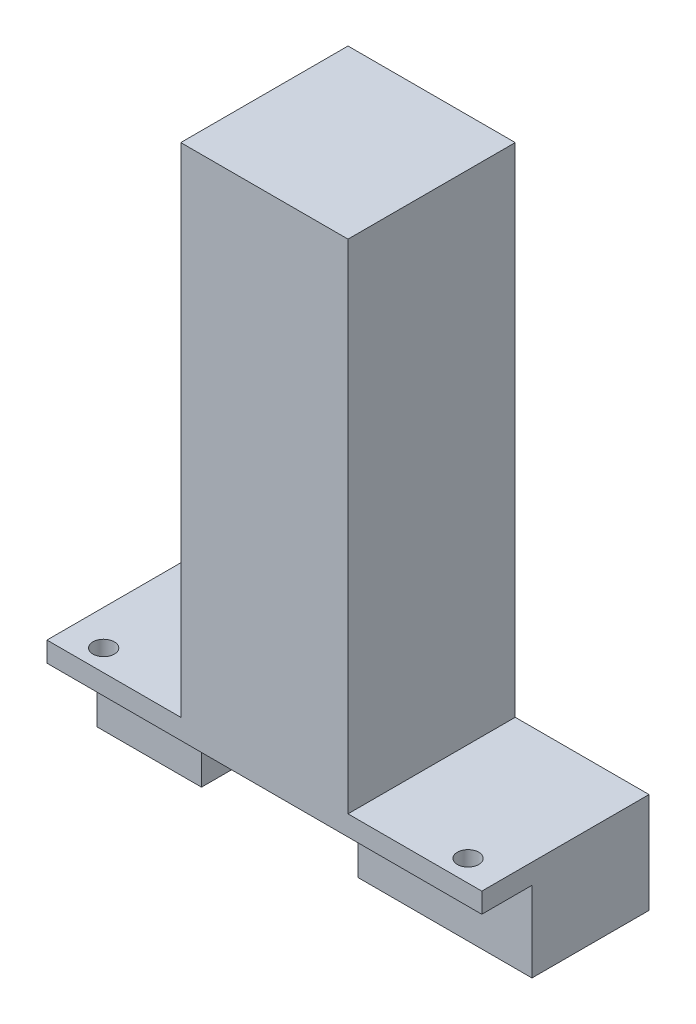
from build123d import *

# Parameters (mm, degrees)
SKETCH2_W           = 65
SKETCH2_H           = 25
BOSS_EXTRUDE1_DEPTH = 3
SKETCH3_W           = 15.6
SKETCH3_H           = 17.5
BOSS_EXTRUDE2_DEPTH = 12
SKETCH5_R           = 1.6
CUT_EXTRUDE1_DEPTH  = 38.91437722
SKETCH6_W           = 25
SKETCH6_H           = 25
BOSS_EXTRUDE3_DEPTH = 74.4


with BuildPart() as part:
    # Sketch2 → Boss-Extrude1 (new body)
    with BuildSketch(Plane(origin=(0, 0, 0), x_dir=(1, 0, 0), z_dir=(0, 1, 0))):
        Rectangle(SKETCH2_W, SKETCH2_H)
    extrude(amount=BOSS_EXTRUDE1_DEPTH)

    # Sketch3 → Boss-Extrude2 (add)
    with BuildSketch(Plane.XZ):
        with Locations((-24.7, -3.75)):
            Rectangle(SKETCH3_W, SKETCH3_H)
        Polygon((32.5, 5), (6.5, 5), (6.5, 0), (12.5, 0), (12.5, -12.5), (32.5, -12.5), align=None)
    extrude(amount=BOSS_EXTRUDE2_DEPTH)

    # Sketch5 → Cut-Extrude1 (cut, through all)
    with BuildSketch(Plane(origin=(0, 3, 0), x_dir=(1, 0, 0), z_dir=(0, 1, 0))):
        with Locations((27.234893969, -9.289666573)):
            Circle(SKETCH5_R)
        with Locations((-27.234893969, -9.289666573)):
            Circle(SKETCH5_R)
    extrude(amount=-CUT_EXTRUDE1_DEPTH, mode=Mode.SUBTRACT)

    # Sketch6 → Boss-Extrude3 (add)
    with BuildSketch(Plane(origin=(0, 3, 0), x_dir=(1, 0, 0), z_dir=(0, 1, 0))):
        Rectangle(SKETCH6_W, SKETCH6_H)
    extrude(amount=BOSS_EXTRUDE3_DEPTH)


solid = part.part
